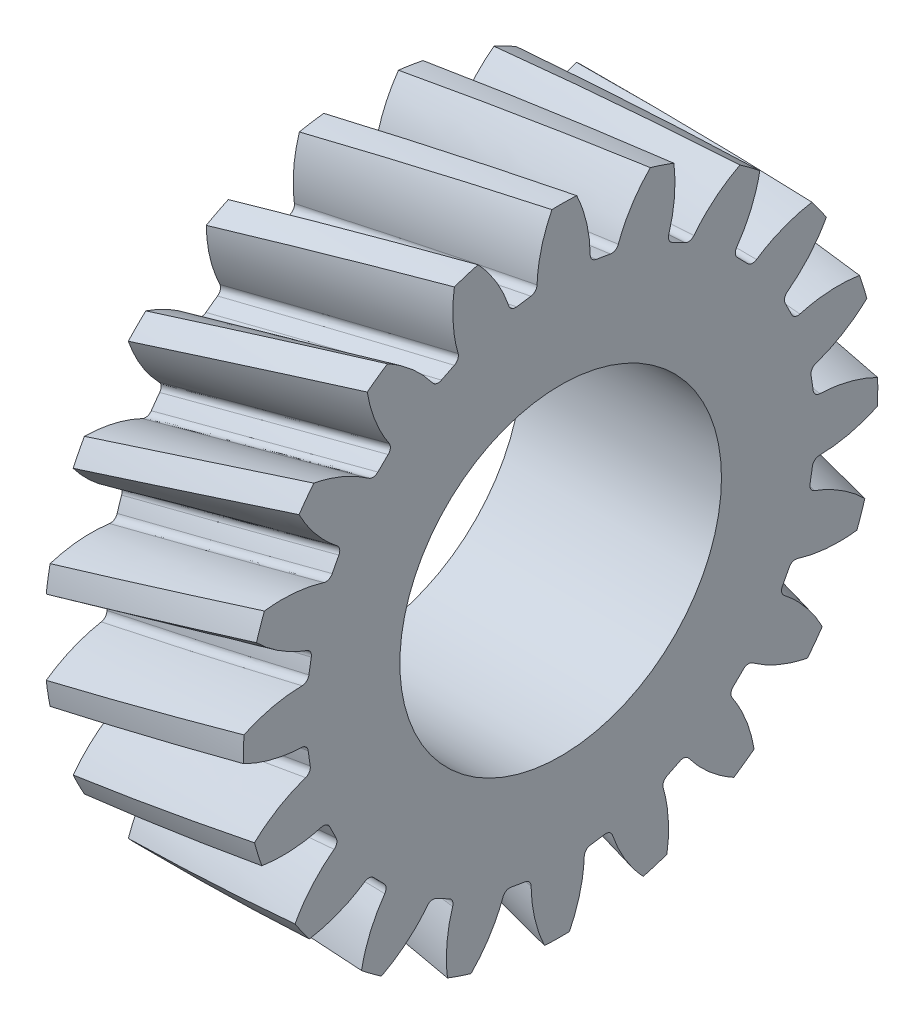
from build123d import *

# Parameters (mm, degrees)
BASPROSKE_W            = 25
BASPROSKE_H            = 39.734666314
TOOTHCUTLH_PITCH       = 931.744818138
TOOTHCUTLH_HEIGHT      = 25
TOOTHCUTLH_RADIUS      = 39.734666314
TOOTHCUTLH_START_ANGLE = -90
TEETHCUTSLH_COUNT      = 20
TEETHCUTSLH_ANGLE      = 342
BORSKE_R               = 20
BORE_DEPTH             = 62.5000025
SKETCH3_R              = 20.15
CUT_EXTRUDE1_DEPTH     = 62.50355628


with BuildPart() as part:
    # BasProSke → Base-Revolve (revolve)
    with BuildSketch(Plane(origin=(0, 0, 0), x_dir=(1, 0, 0), z_dir=(0, 1, 0)), mode=Mode.PRIVATE) as base_revolve_sk:
        with Locations((12.5, 19.867333157)):
            Rectangle(BASPROSKE_W, BASPROSKE_H)
    revolve(base_revolve_sk.sketch.rotate(Axis((-10, 0, 0), (1, 0, 0)), 180), axis=Axis((-10, 0, 0), (1, 0, 0)))

    # ToothCutLH: sweep along a helix
    with BuildLine() as toothcutlh_path:
        add(Helix(TOOTHCUTLH_PITCH, TOOTHCUTLH_HEIGHT, TOOTHCUTLH_RADIUS, center=(0, 0, 0), direction=(1, 0, 0), lefthand=True, mode=Mode.PRIVATE).rotate(Axis((0, 0, 0), (1, 0, 0)), TOOTHCUTLH_START_ANGLE))
    # TooCutSkeRH<3> → ToothCutLH (sweep, cut)
    with BuildSketch(Plane(origin=(0, 0, 0), x_dir=(0, 0, -1), z_dir=(1, 0, 0))):
        with BuildLine():
            ThreePointArc((0.89881572, 31.846985226), (0, 31.859666314), (-0.89881572, 31.846985226))
            ThreePointArc((-0.89881572, 31.846985226), (-1.474583026, 32.041669843), (-1.785076396, 32.56416765))
            ThreePointArc((-1.785076396, 32.56416765), (-3.137510458, 36.797541758), (-5.512705556, 40.553734308))
            ThreePointArc((-5.512705556, 40.553734308), (0, 40.926706304), (5.512705556, 40.553734308))
            ThreePointArc((5.512705556, 40.553734308), (3.137510458, 36.797541758), (1.785076396, 32.56416765))
            ThreePointArc((1.785076396, 32.56416765), (1.474583026, 32.041669843), (0.89881572, 31.846985226))
        make_face()
    toothcutlh = sweep(path=toothcutlh_path.line, is_frenet=True, mode=Mode.SUBTRACT)

    # TeethCutsLH: ToothCutLH ×20 about axis
    teethcutslh_axis = Axis((-10, 0, 0), (1, 0, 0))
    for i in range(1, TEETHCUTSLH_COUNT):
        add(toothcutlh.rotate(teethcutslh_axis, i * TEETHCUTSLH_ANGLE / (TEETHCUTSLH_COUNT - 1)), mode=Mode.SUBTRACT)

    # BorSke → Bore (cut, symmetric)
    with BuildSketch(Plane(origin=(0, 0, 0), x_dir=(0, 0, -1), z_dir=(1, 0, 0))):
        with Locations(Location((0, 0, 0), (0, 0, 180))):
            Circle(BORSKE_R)
    extrude(amount=BORE_DEPTH, both=True, mode=Mode.SUBTRACT)

    # Sketch3 → Cut-Extrude1 (cut, through all)
    with BuildSketch(Plane(origin=(25, 0, 0), x_dir=(0, 0, -1), z_dir=(1, 0, 0))):
        Circle(SKETCH3_R)
    extrude(amount=-CUT_EXTRUDE1_DEPTH, mode=Mode.SUBTRACT)


solid = part.part
